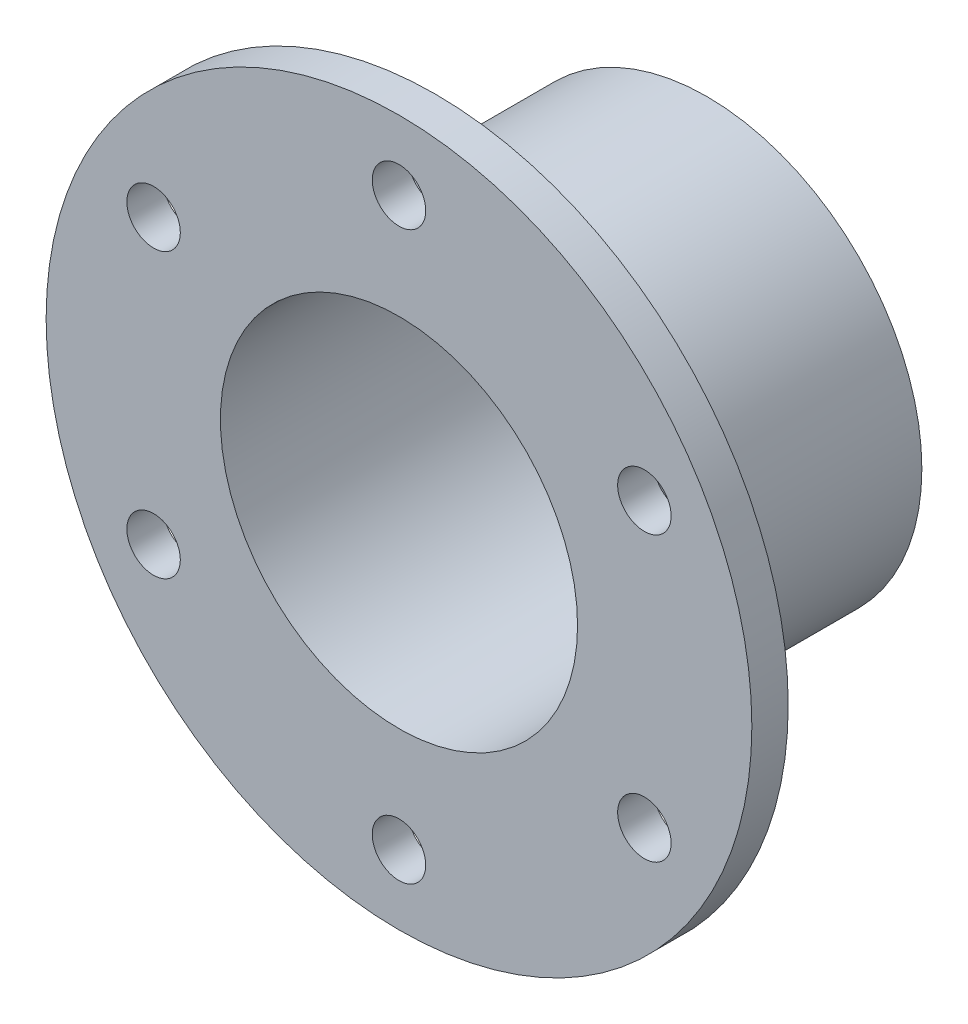
from build123d import *

# Parameters (mm, degrees)
CROQUIS1_R              = 20.1
CROQUIS1_R_2            = 16.7
SALIENTE_EXTRUIR1_DEPTH = 25.4
CROQUIS2_R              = 33
CROQUIS2_R_2            = 16.7
CROQUIS2_R_3            = 2.5
SALIENTE_EXTRUIR2_DEPTH = 3.4


with BuildPart() as part:
    # Croquis1 → Saliente-Extruir1 (new body)
    with BuildSketch(Plane.XY):
        Circle(CROQUIS1_R)
        Circle(CROQUIS1_R_2, mode=Mode.SUBTRACT)
    extrude(amount=SALIENTE_EXTRUIR1_DEPTH)

    # Croquis2 → Saliente-Extruir2 (add)
    with BuildSketch(Plane.XY.offset(25.4)):
        Circle(CROQUIS2_R)
        Circle(CROQUIS2_R_2, mode=Mode.SUBTRACT)
        with Locations((0, 26.5)):
            Circle(CROQUIS2_R_3, mode=Mode.SUBTRACT)
        with Locations((22.9496732, 13.25)):
            Circle(CROQUIS2_R_3, mode=Mode.SUBTRACT)
        with Locations((22.9496732, -13.25)):
            Circle(CROQUIS2_R_3, mode=Mode.SUBTRACT)
        with Locations((0, -26.5)):
            Circle(CROQUIS2_R_3, mode=Mode.SUBTRACT)
        with Locations((-22.9496732, -13.25)):
            Circle(CROQUIS2_R_3, mode=Mode.SUBTRACT)
        with Locations((-22.9496732, 13.25)):
            Circle(CROQUIS2_R_3, mode=Mode.SUBTRACT)
    extrude(amount=SALIENTE_EXTRUIR2_DEPTH)


solid = part.part
